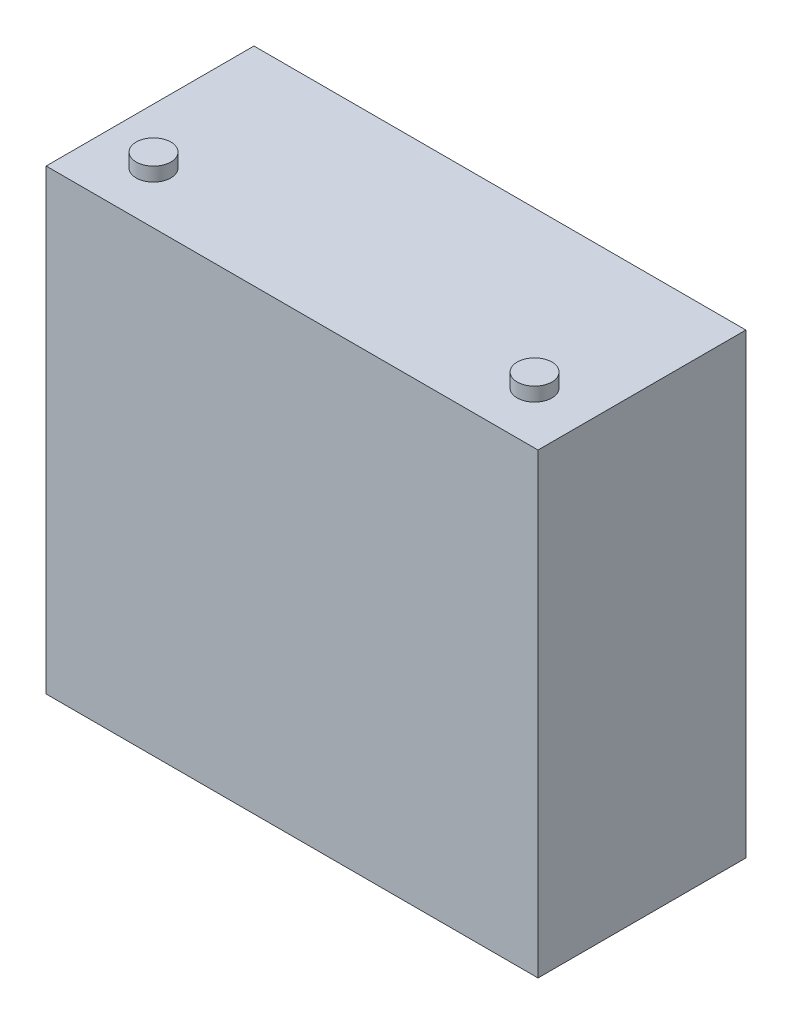
from build123d import *

# Parameters (mm, degrees)
SKETCH1_W           = 180.34
SKETCH1_H           = 76.2
BOSS_EXTRUDE1_DEPTH = 167.64
SKETCH2_R           = 6.35
BOSS_EXTRUDE2_DEPTH = 5.08


with BuildPart() as part:
    # Sketch1 → Boss-Extrude1 (new body)
    with BuildSketch(Plane(origin=(0, 0, 0), x_dir=(1, 0, 0), z_dir=(0, 1, 0))):
        Rectangle(SKETCH1_W, SKETCH1_H)
    extrude(amount=BOSS_EXTRUDE1_DEPTH)

    # Sketch2 → Boss-Extrude2 (add)
    with BuildSketch(Plane(origin=(0, 167.64, 0), x_dir=(1, 0, 0), z_dir=(0, 1, 0))):
        with Locations((-69.85, -19.05)):
            Circle(SKETCH2_R)
        with Locations((69.85, -19.05)):
            Circle(SKETCH2_R)
    extrude(amount=BOSS_EXTRUDE2_DEPTH)


solid = part.part
